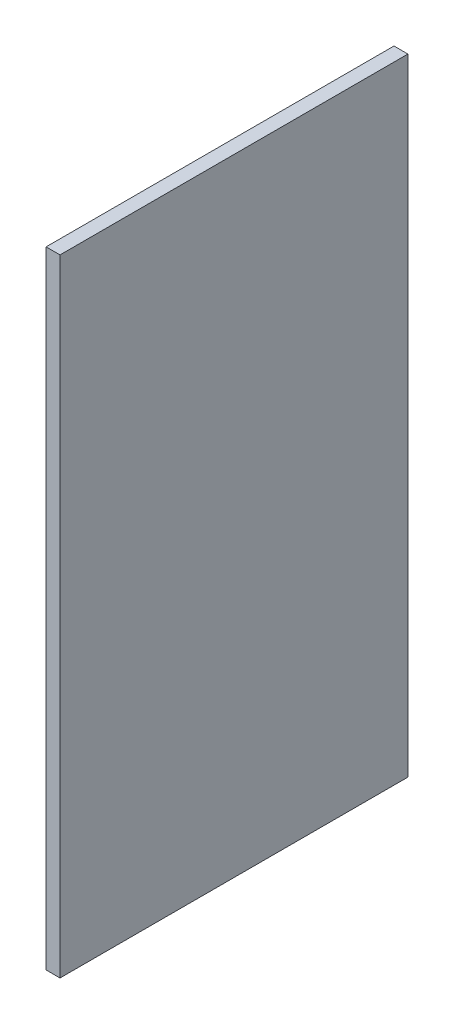
from build123d import *

# Parameters (mm, degrees)
SKETCH1_W           = 50
SKETCH1_H           = 90
BOSS_EXTRUDE1_DEPTH = 2


with BuildPart() as part:
    # Sketch1 → Boss-Extrude1 (new body)
    with BuildSketch(Plane(origin=(0, 0, 0), x_dir=(0, 0, -1), z_dir=(1, 0, 0))):
        with Locations((-51.687111779, 12.829446091)):
            Rectangle(SKETCH1_W, SKETCH1_H)
    extrude(amount=BOSS_EXTRUDE1_DEPTH)


solid = part.part
